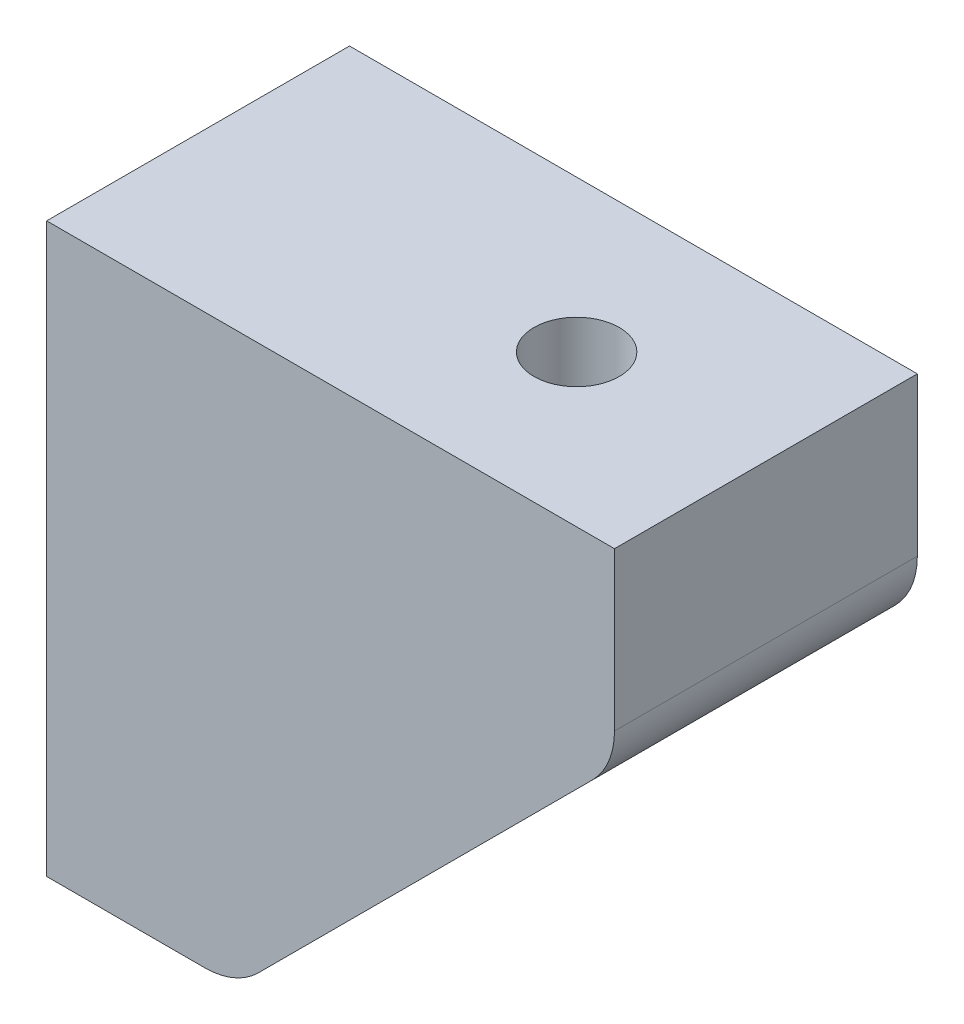
from build123d import *

# Parameters (mm, degrees)
BOSS_EXTRUDE1_DEPTH = 16
SKETCH3_R           = 2.25
CUT_EXTRUDE1_DEPTH  = 46.343136195
SKETCH2_R           = 2.5
CUT_EXTRUDE2_DEPTH  = 46.343136195
SKETCH4_R           = 5
CUT_EXTRUDE3_DEPTH  = 40.446165923
SKETCH5_R           = 4
CUT_EXTRUDE4_DEPTH  = 40.446165847
CHAMFER1_SIZE       = 3
FILLET2_R           = 4


with BuildPart() as part:
    # Sketch1 → Boss-Extrude1 (new body)
    with BuildSketch(Plane.XY):
        Polygon((0, 0), (10, 0), (30, 20), (30, 30), (0, 30), align=None)
    extrude(amount=BOSS_EXTRUDE1_DEPTH)

    # Sketch3 → Cut-Extrude1 (cut, through all)
    with BuildSketch(Plane(origin=(0, 30, 0), x_dir=(1, 0, 0), z_dir=(0, 1, 0))):
        with Locations(Location((20, -8, 0), (0, 0, 180))):
            Circle(SKETCH3_R)
    extrude(amount=-CUT_EXTRUDE1_DEPTH, mode=Mode.SUBTRACT)

    # Sketch2 → Cut-Extrude2 (cut, through all)
    with BuildSketch(Plane.ZY):
        with Locations(Location((8, 10, 0), (0, 0, 270))):
            Circle(SKETCH2_R)
    extrude(amount=-CUT_EXTRUDE2_DEPTH, mode=Mode.SUBTRACT)

    # Sketch4 → Cut-Extrude3 (cut, through all)
    with BuildSketch(Plane.ZY.offset(-10)):
        with Locations(Location((8, 10, 0), (0, 0, 270))):
            Circle(SKETCH4_R)
    extrude(amount=-CUT_EXTRUDE3_DEPTH, mode=Mode.SUBTRACT)

    # Sketch5 → Cut-Extrude4 (cut, through all)
    with BuildSketch(Plane(origin=(0, 20, 0), x_dir=(1, 0, 0), z_dir=(0, 1, 0))):
        with Locations(Location((20, -8, 0), (0, 0, 180))):
            Circle(SKETCH5_R)
    extrude(amount=-CUT_EXTRUDE4_DEPTH, mode=Mode.SUBTRACT)

    # Chamfer1
    # the kernel refuses this chamfer: 3 mm, written as the material it adds along each edge
    with BuildSketch(Plane(origin=(10, 10, 8), x_dir=(0, -1, 0), z_dir=(0, 0, -1))) as chamfer1_piece_1_section:
        Polygon((5, -CHAMFER1_SIZE), (5 - CHAMFER1_SIZE, 0), (5, 0), align=None)
    chamfer1_piece_1 = revolve(axis=Axis((10, 10, 8), (-1, 0, 0)), mode=Mode.PRIVATE)
    chamfer1_piece_1 = chamfer1_piece_1 - Plane(origin=(11.757355127, 10, 8), x_dir=(0, -1, 0), z_dir=(-1, 0, 0)) * Cylinder(2.5, 21, mode=Mode.PRIVATE)
    add(chamfer1_piece_1)

    # Fillet2
    fillet2_edges = [part.edges().sort_by_distance(p)[0] for p in [
        (30, 20, 8),
        (10, 0, 8),
    ]]
    fillet(fillet2_edges, radius=FILLET2_R)


solid = part.part
